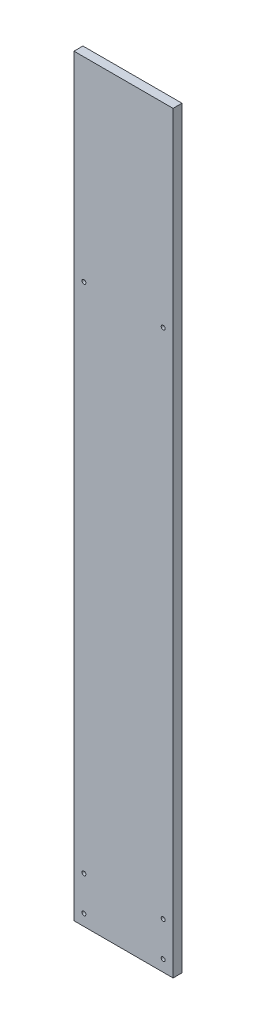
from build123d import *

# Parameters (mm, degrees)
SKETCH1_W                = 100
SKETCH1_H                = 760
BOSS_EXTRUDE1_DEPTH      = 9
F_4_0_4_DIAMETER_HOLE1_D = 4


with BuildPart() as part:
    # Sketch1 → Boss-Extrude1 (new body)
    with BuildSketch(Plane.XY):
        with Locations((-180.300605602, -198.433128803)):
            Rectangle(SKETCH1_W, SKETCH1_H)
    extrude(amount=BOSS_EXTRUDE1_DEPTH)

    # Ø4.0 (4) Diameter Hole1 (through all)
    with Locations(Plane(origin=(-171.596169666, -73.097017265, 9), x_dir=(1, 0, 0), z_dir=(0, 0, 1))):
        with Locations((-48.704435936, -458.836111538), (-48.704435936, -493.836111538), (31.295564064, -493.836111538), (31.295564064, -458.836111538), (31.295564064, 58.078352635), (-48.704435936, 58.078352635)):
            Hole(F_4_0_4_DIAMETER_HOLE1_D / 2)


solid = part.part
